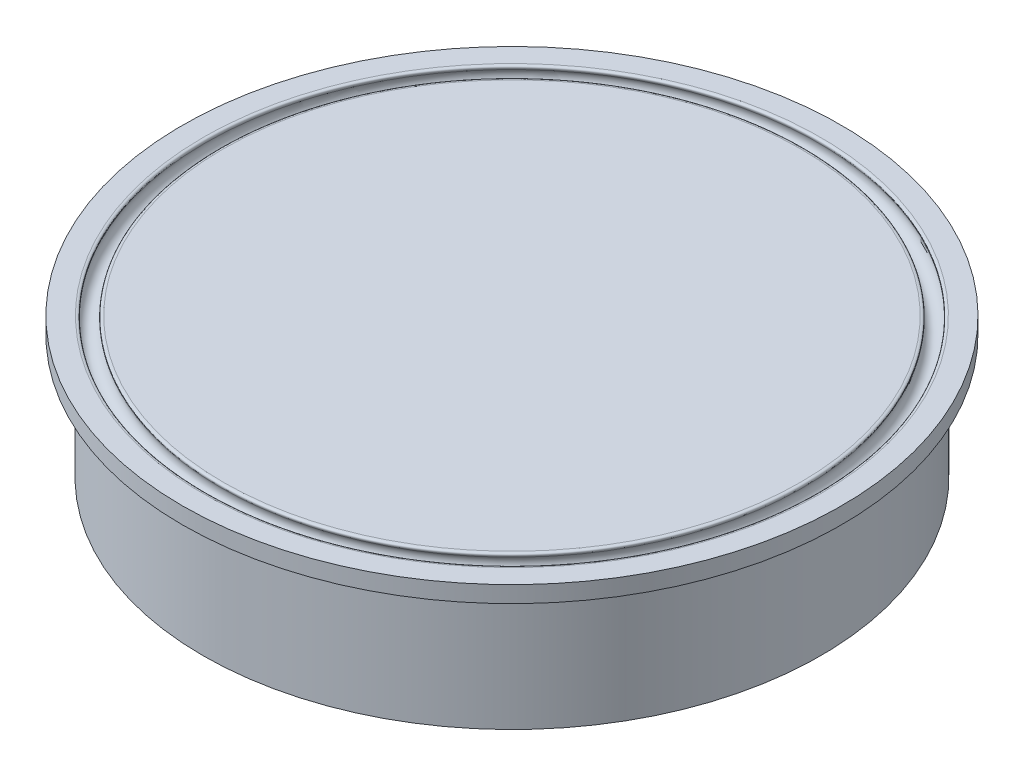
from build123d import *

# Parameters (mm, degrees)
CROQUIS1_R              = 37.5
CROQUIS1_R_2            = 35
SALIENTE_EXTRUIR1_DEPTH = 15
CROQUIS2_R              = 40
SALIENTE_EXTRUIR2_DEPTH = 2
CROQUIS5_R              = 1.1


with BuildPart() as part:
    # Croquis1 → Saliente-Extruir1 (new body)
    with BuildSketch(Plane(origin=(0, 17, 0), x_dir=(1, 0, 0), z_dir=(0, 1, 0))):
        with Locations(Location((13.541348433, 6.626768313, 0), (0, 0, 270))):
            Circle(CROQUIS1_R)
        with Locations(Location((13.541348433, 6.626768313, 0), (0, 0, 270))):
            Circle(CROQUIS1_R_2, mode=Mode.SUBTRACT)
    extrude(amount=SALIENTE_EXTRUIR1_DEPTH)

    # Croquis2 → Saliente-Extruir2 (add)
    with BuildSketch(Plane(origin=(0, 32, 0), x_dir=(1, 0, 0), z_dir=(0, 1, 0))):
        with Locations(Location((13.541348433, 6.626768313, 0), (0, 0, 270))):
            Circle(CROQUIS2_R)
    extrude(amount=SALIENTE_EXTRUIR2_DEPTH)

    # Cortar-Barrer1: sweep along a path in Croquis6
    with BuildLine(Plane(origin=(0, 33, 0), x_dir=(1, 0, 0), z_dir=(0, 1, 0))) as cortar_barrer1_path:
        CenterArc((13.541348433, 6.626768313), 36.25, 0, 360)
    # Croquis5 → Cortar-Barrer1 (sweep, cut)
    with BuildSketch(Plane.XY.offset(-6.626768313)):
        with Locations((-22.708651567, 33)):
            Circle(CROQUIS5_R)
    sweep(path=cortar_barrer1_path.line, mode=Mode.SUBTRACT)

    # Redondeo1
    # a fillet whose section is not a circle: 0.3 mm, written as the material it takes off along each edge
    with BuildSketch(Plane(origin=(13.541348433, 34, -6.626768313), x_dir=(1, 0, 0), z_dir=(0, 0, 1))) as redondeo1_piece_1:
        with BuildLine():
            Bezier((37.462435565, 0), (36.942820323, 0), (37.202627944, -0.45), weights=[1, 1, 1])
            ThreePointArc((37.202627944, -0.45), (36.990455592, -0.186534871), (36.708257569, 0))
            Line((36.708257569, 0), (37.462435565, 0))
        make_face()
    revolve(axis=Axis((13.541348433, 34, -6.626768313), (0, 1, 0)), mode=Mode.SUBTRACT)
    with BuildSketch(Plane(origin=(13.541348433, 34, -6.626768313), x_dir=(1, 0, 0), z_dir=(0, 0, 1))) as redondeo1_piece_2:
        with BuildLine():
            Bezier((35.297372056, -0.45), (35.557179677, 0), (35.037564435, 0), weights=[1, 1, 1])
            Line((35.037564435, 0), (35.791742431, 0))
            ThreePointArc((35.791742431, 0), (35.509544408, -0.186534871), (35.297372056, -0.45))
        make_face()
    revolve(axis=Axis((13.541348433, 34, -6.626768313), (0, 1, 0)), mode=Mode.SUBTRACT)


solid = part.part
